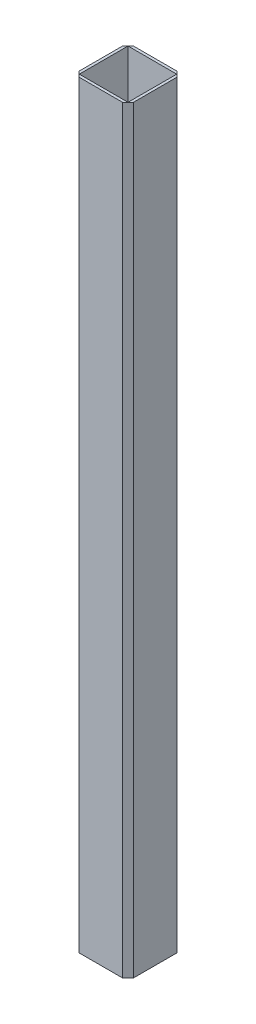
from build123d import *

# Parameters (mm, degrees)
SKETCH1_W           = 50
SKETCH1_H           = 700
BOSS_EXTRUDE1_DEPTH = 50
SKETCH2_W           = 45
SKETCH2_H           = 45
CUT_EXTRUDE1_DEPTH  = 704.562363974
CHAMFER5_SIZE       = 5


with BuildPart() as part:
    # Sketch1 → Boss-Extrude1 (new body)
    with BuildSketch(Plane.XY):
        with Locations((25, 350)):
            Rectangle(SKETCH1_W, SKETCH1_H)
    extrude(amount=BOSS_EXTRUDE1_DEPTH)

    # Sketch2 → Cut-Extrude1 (cut, through all)
    with BuildSketch(Plane(origin=(0, 700, 0), x_dir=(1, 0, 0), z_dir=(0, 1, 0))):
        with Locations((25, -25)):
            Rectangle(SKETCH2_W, SKETCH2_H)
    extrude(amount=-CUT_EXTRUDE1_DEPTH, mode=Mode.SUBTRACT)

    # Chamfer5
    chamfer5_edges = [part.edges().sort_by_distance(p)[0] for p in [
        (50, 350, 50),
        (0, 350, 50),
        (50, 350, 0),
        (0, 350, 0),
    ]]
    chamfer(chamfer5_edges, length=CHAMFER5_SIZE - 0.0001)  # a hair under: the kernel refuses the full size


solid = part.part
